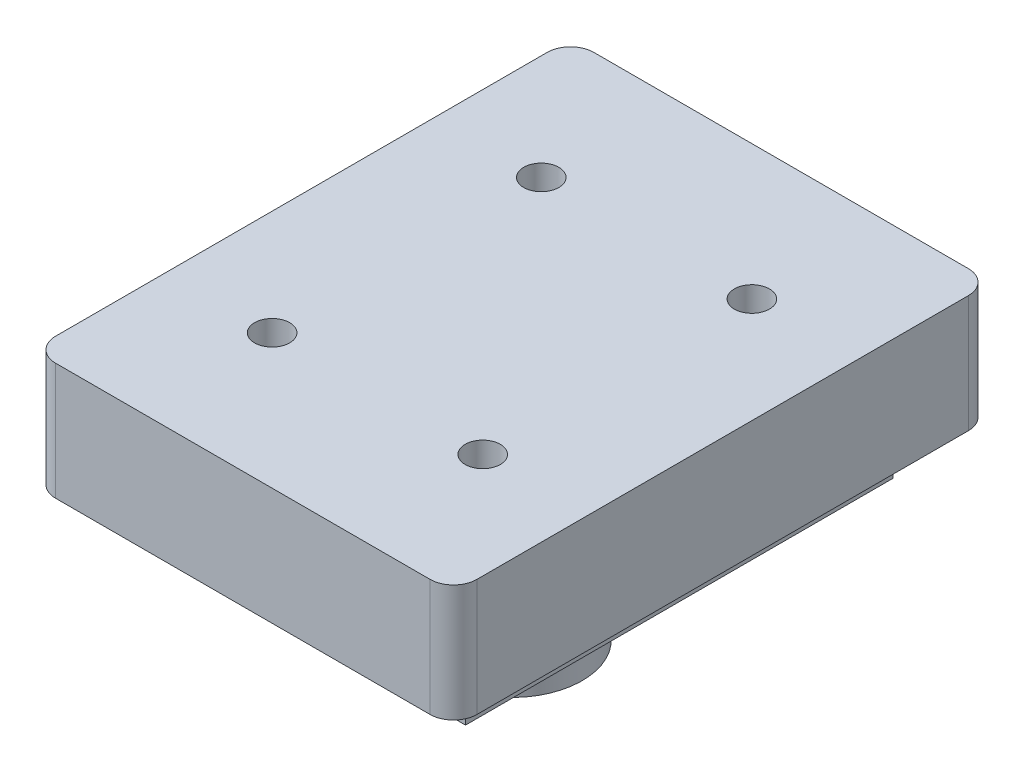
from build123d import *

# Parameters (mm, degrees)
SKETCH1_W           = 45.72
SKETCH1_H           = 58.42
BOSS_EXTRUDE1_DEPTH = 12.7
SKETCH2_R           = 1.905
CUT_EXTRUDE1_DEPTH  = 42.348948188
SKETCH3_W           = 36.327462092
SKETCH3_H           = 46.418423785
BOSS_EXTRUDE2_DEPTH = 5.08
SKETCH4_R           = 7.62
SKETCH4_R_2         = 5.08
BOSS_EXTRUDE3_DEPTH = 12.7
FILLET1_R           = 2.54


with BuildPart() as part:
    # Sketch1 → Boss-Extrude1 (new body)
    with BuildSketch(Plane(origin=(0, 0, 0), x_dir=(1, 0, 0), z_dir=(0, 1, 0))):
        with Locations((2.874210526, -0.559043062)):
            Rectangle(SKETCH1_W, SKETCH1_H)
    extrude(amount=BOSS_EXTRUDE1_DEPTH)

    # Sketch2 → Cut-Extrude1 (cut, through all)
    with BuildSketch(Plane(origin=(0, 12.7, 0), x_dir=(1, 0, 0), z_dir=(0, 1, 0))):
        with Locations((-8.555789474, 14.045956938)):
            Circle(SKETCH2_R)
        with Locations((14.304210526, 14.045956938)):
            Circle(SKETCH2_R)
        with Locations((-8.555789474, -15.164043062)):
            Circle(SKETCH2_R)
        with Locations((14.304210526, -15.164043062)):
            Circle(SKETCH2_R)
    extrude(amount=-CUT_EXTRUDE1_DEPTH, mode=Mode.SUBTRACT)

    # Sketch3 → Boss-Extrude2 (add)
    with BuildSketch(Plane.XZ):
        with Locations((2.874210526, 0.559043062)):
            Rectangle(SKETCH3_W, SKETCH3_H)
    extrude(amount=BOSS_EXTRUDE2_DEPTH)

    # Sketch4 → Boss-Extrude3 (add)
    with BuildSketch(Plane.XZ.offset(5.08)):
        with Locations((2.874210526, 0.559043062)):
            Circle(SKETCH4_R)
        with Locations((2.874210526, 0.559043062)):
            Circle(SKETCH4_R_2, mode=Mode.SUBTRACT)
    extrude(amount=BOSS_EXTRUDE3_DEPTH)

    # Fillet1
    fillet1_edges = [part.edges().sort_by_distance(p)[0] for p in [
        (25.734210526, 6.35, -28.650956938),
        (-19.985789474, 6.35, -28.650956938),
        (-19.985789474, 6.35, 29.769043062),
        (25.734210526, 6.35, 29.769043062),
    ]]
    fillet(fillet1_edges, radius=FILLET1_R)


solid = part.part
